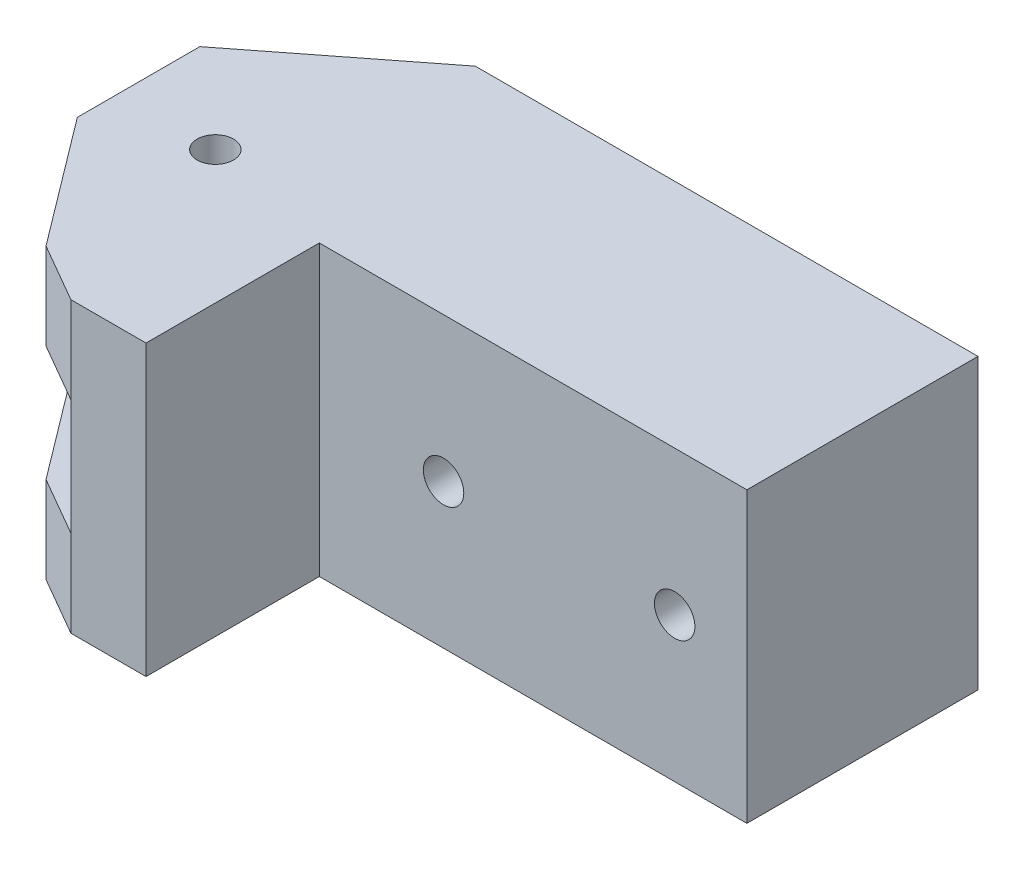
from build123d import *

# Parameters (mm, degrees)
SKETCH1_R           = 1.575
BOSS_EXTRUDE1_DEPTH = 12.5
SKETCH2_W           = 13.385271969
SKETCH2_H           = 10
CUT_EXTRUDE1_DEPTH  = 68.949865099
SKETCH3_R           = 1.75
CUT_EXTRUDE2_DEPTH  = 25


with BuildPart() as part:
    # Sketch1 → Boss-Extrude1 (new, symmetric)
    with BuildSketch(Plane(origin=(0, 0, 0), x_dir=(1, 0, 0), z_dir=(0, 1, 0))):
        Polygon((0, 0), (-43.5, 0), (-56.885271969, -10.457720596), (-56.885271969, -21.057720596), (-48.596177418, -32.057720596), (-43.5, -35), (-37, -35), (-37, -20), (0, -20), align=None)
        with Locations((-48.5, -17.5)):
            Circle(SKETCH1_R, mode=Mode.SUBTRACT)
    extrude(amount=BOSS_EXTRUDE1_DEPTH, both=True)

    # Sketch2 → Cut-Extrude1 (cut, through all)
    with BuildSketch(Plane.XY.offset(35)):
        with Locations((-50.192635985, 0)):
            Rectangle(SKETCH2_W, SKETCH2_H)
    extrude(amount=-CUT_EXTRUDE1_DEPTH, mode=Mode.SUBTRACT)

    # Sketch3 → Cut-Extrude2 (cut)
    with BuildSketch(Plane.XY.offset(20)):
        with Locations((-26.25, 0)):
            Circle(SKETCH3_R)
        with Locations((-6.25, 0)):
            Circle(SKETCH3_R)
    extrude(amount=-CUT_EXTRUDE2_DEPTH, mode=Mode.SUBTRACT)


solid = part.part
